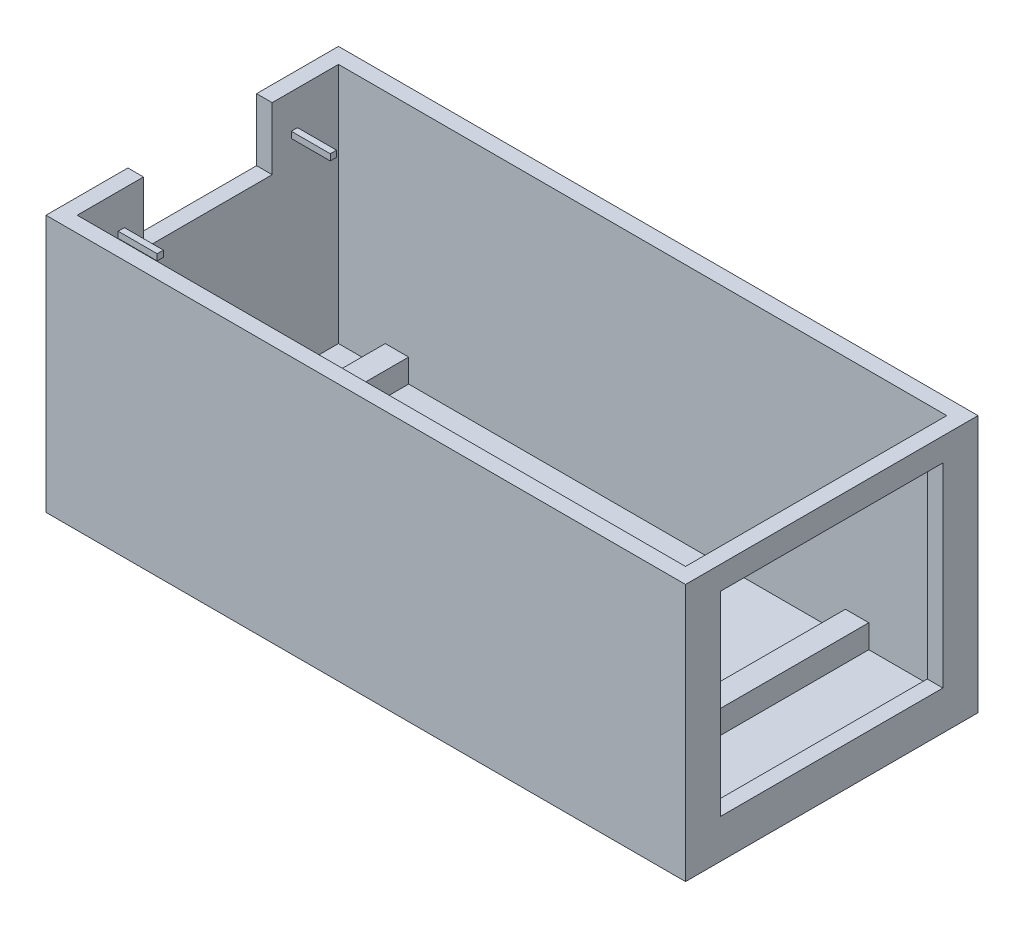
from build123d import *

# Parameters (mm, degrees)
SKETCH1_W           = 82
SKETCH1_H           = 37.5
BOSS_EXTRUDE2_DEPTH = 2
SKETCH2_W           = 3
SKETCH2_H           = 37.5
BOSS_EXTRUDE4_DEPTH = 3
BOSS_EXTRUDE5_DEPTH = 31
SKETCH6_W           = 16.5
SKETCH6_H           = 8
CUT_EXTRUDE1_DEPTH  = 2
SKETCH7_W           = 28.5
SKETCH7_H           = 25
CUT_EXTRUDE2_DEPTH  = 2
SKETCH8_W           = 0.8
SKETCH8_H           = 0.8
BOSS_EXTRUDE6_DEPTH = 5
SKETCH9_W           = 35
SKETCH9_H           = 2
BOSS_EXTRUDE7_DEPTH = 2.4


with BuildPart() as part:
    # Sketch1 → Boss-Extrude2 (new body)
    with BuildSketch(Plane(origin=(0, 0, 0), x_dir=(1, 0, 0), z_dir=(0, 1, 0))):
        with Locations((41, 18.75)):
            Rectangle(SKETCH1_W, SKETCH1_H)
    extrude(amount=BOSS_EXTRUDE2_DEPTH)

    # Sketch2 → Boss-Extrude4 (add)
    with BuildSketch(Plane(origin=(0, 2, 0), x_dir=(1, 0, 0), z_dir=(0, 1, 0))):
        with Locations((9.5, 18.75)):
            Rectangle(SKETCH2_W, SKETCH2_H)
        with Locations((68.5, 18.75)):
            Rectangle(SKETCH2_W, SKETCH2_H)
    extrude(amount=BOSS_EXTRUDE4_DEPTH)

    # Sketch4 → Boss-Extrude5 (add)
    with BuildSketch(Plane(origin=(0, 2, 0), x_dir=(1, 0, 0), z_dir=(0, 1, 0))):
        Polygon((11, 37.5), (8, 37.5), (0, 37.5), (0, 0), (8, 0), (11, 0), (67, 0), (70, 0), (82, 0), (82, 37.5), (70, 37.5), (67, 37.5), align=None)
        Polygon((2, 2), (2, 35.5), (8, 35.5), (11, 35.5), (67, 35.5), (70, 35.5), (80, 35.5), (80, 2), (70, 2), (67, 2), (11, 2), (8, 2), align=None, mode=Mode.SUBTRACT)
    extrude(amount=BOSS_EXTRUDE5_DEPTH)

    # Sketch6 → Cut-Extrude1 (cut)
    with BuildSketch(Plane.ZY):
        with Locations((-18.75, 29)):
            Rectangle(SKETCH6_W, SKETCH6_H)
    extrude(amount=-CUT_EXTRUDE1_DEPTH, mode=Mode.SUBTRACT)

    # Sketch7 → Cut-Extrude2 (cut)
    with BuildSketch(Plane(origin=(82, 0, 0), x_dir=(0, 0, -1), z_dir=(1, 0, 0))):
        with Locations((18.75, 17.5)):
            Rectangle(SKETCH7_W, SKETCH7_H)
    extrude(amount=-CUT_EXTRUDE2_DEPTH, mode=Mode.SUBTRACT)

    # Sketch8 → Boss-Extrude6 (add)
    with BuildSketch(Plane(origin=(2, 0, 0), x_dir=(0, 0, -1), z_dir=(1, 0, 0))):
        with Locations((7.65, 28.2)):
            Rectangle(SKETCH8_W, SKETCH8_H)
        with Locations((29.85, 28.2)):
            Rectangle(SKETCH8_W, SKETCH8_H)
    extrude(amount=BOSS_EXTRUDE6_DEPTH)

    # Sketch9 → Boss-Extrude7 (add)
    with BuildSketch(Plane(origin=(0, 0, -37.5), x_dir=(-1, 0, 0), z_dir=(0, 0, -1))):
        with Locations((-52.5, 26)):
            Rectangle(SKETCH9_W, SKETCH9_H)
        with Locations((-52.5, 5)):
            Rectangle(SKETCH9_W, SKETCH9_H)
    extrude(amount=BOSS_EXTRUDE7_DEPTH)


solid = part.part
